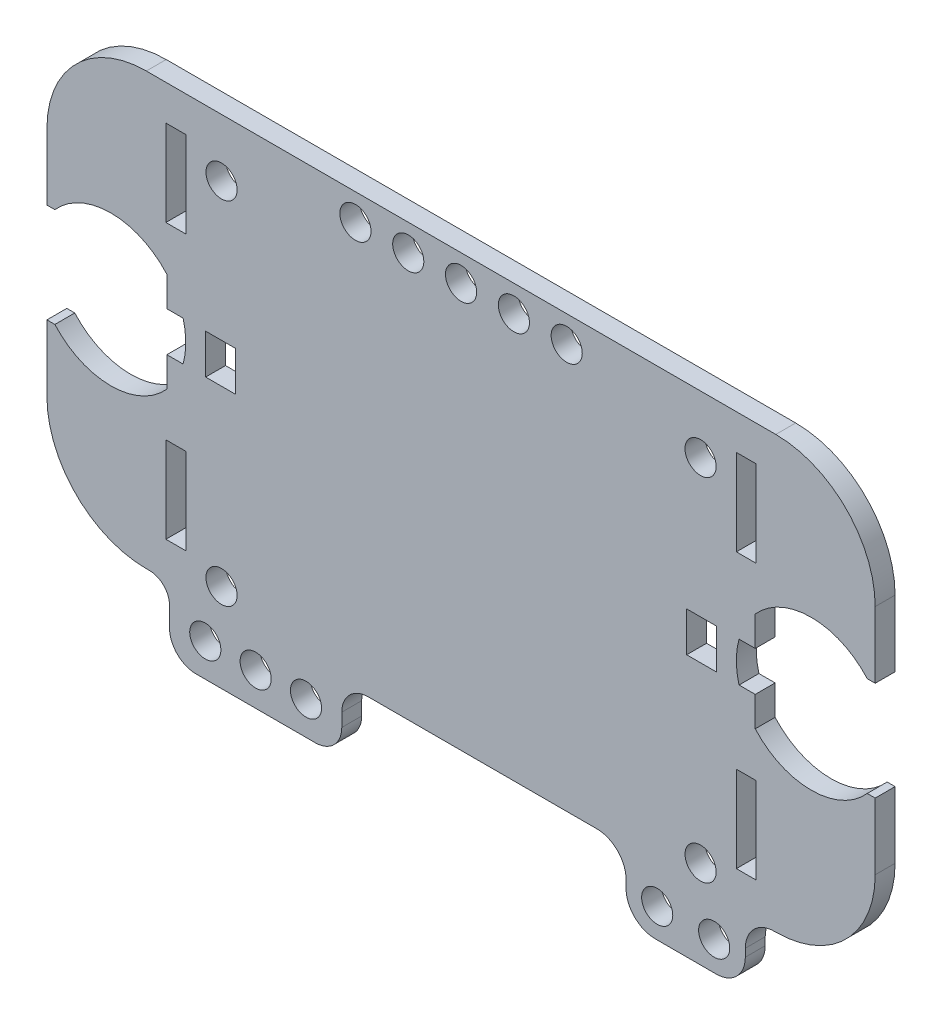
from build123d import *

# Parameters (mm, degrees)
SKICA2_R                 = 2.35
SKICA2_W                 = 4.5
SKICA2_H                 = 6
SKICA2_W_2               = 3
SKICA2_H_2               = 13
P_IDAT_VYSUNUT_M1_DEPTH  = 3
ODEBRAT_VYSUNUT_M2_DEPTH = 76.654647081


with BuildPart() as part:
    # Skica2 → Přidat vysunutím1 (new body)
    with BuildSketch(Plane.XY):
        with BuildLine():
            Line((-62.5, 7.5), (-61.3, 7.5))
            ThreePointArc((-61.3, 7.5), (-52.847781356, 11.3), (-44.395562713, 7.5))
            Line((-44.395562713, 7.5), (-44.395562713, 3))
            Line((-44.395562713, 3), (-41.953287334, 3))
            ThreePointArc((-41.953287334, 3), (-41.547781356, 0), (-41.953287334, -3))
            Line((-41.953287334, -3), (-44.395562713, -3))
            Line((-44.395562713, -3), (-44.395562713, -7.5))
            ThreePointArc((-44.395562713, -7.5), (-52.847781356, -11.3), (-61.3, -7.5))
            Line((-61.3, -7.5), (-62.5, -7.5))
            Line((-62.5, -7.5), (-62.5, -32.525))
            Line((-62.5, -32.525), (-47, -32.525))
            ThreePointArc((-47, -32.525), (-44.878679656, -33.403679656), (-44, -35.525))
            Line((-44, -35.525), (-44, -38.525))
            ThreePointArc((-44, -38.525), (-42.828427125, -41.353427125), (-40, -42.525))
            Line((-40, -42.525), (-22, -42.525))
            ThreePointArc((-22, -42.525), (-19.171572875, -41.353427125), (-18, -38.525))
            Line((-18, -38.525), (-18, -36.525))
            ThreePointArc((-18, -36.525), (-16.828427125, -33.696572875), (-14, -32.525))
            Line((-14, -32.525), (20.5, -32.525))
            ThreePointArc((20.5, -32.525), (23.611269837, -33.813730163), (24.9, -36.925))
            Line((24.9, -36.925), (24.9, -38.1))
            ThreePointArc((24.9, -38.1), (26.188730163, -41.211269837), (29.3, -42.5))
            Line((29.3, -42.5), (38.5, -42.5))
            ThreePointArc((38.5, -42.5), (41.611269837, -41.211269837), (42.9, -38.1))
            Line((42.9, -38.1), (42.9, -36.925))
            ThreePointArc((42.9, -36.925), (44.188730163, -33.813730163), (47.3, -32.525))
            Line((47.3, -32.525), (62.5, -32.525))
            Line((62.5, -32.525), (62.5, -7.5))
            Line((62.5, -7.5), (61.3, -7.5))
            ThreePointArc((61.3, -7.5), (52.847781356, -11.3), (44.395562713, -7.5))
            Line((44.395562713, -7.5), (44.395562713, -3))
            Line((44.395562713, -3), (41.953287334, -3))
            ThreePointArc((41.953287334, -3), (41.547781356, 0), (41.953287334, 3))
            Line((41.953287334, 3), (44.395562713, 3))
            Line((44.395562713, 3), (44.395562713, 7.5))
            ThreePointArc((44.395562713, 7.5), (52.847781356, 11.3), (61.3, 7.5))
            Line((61.3, 7.5), (62.5, 7.5))
            Line((62.5, 7.5), (62.5, 32.525))
            Line((62.5, 32.525), (-62.5, 32.525))
            Line((-62.5, 32.525), (-62.5, 7.5))
        make_face()
        with Locations((-15.94, 28.525)):
            Circle(SKICA2_R, mode=Mode.SUBTRACT)
        with Locations((-7.97, 28.525)):
            Circle(SKICA2_R, mode=Mode.SUBTRACT)
        with Locations((0, 28.525)):
            Circle(SKICA2_R, mode=Mode.SUBTRACT)
        with Locations((7.97, 28.525)):
            Circle(SKICA2_R, mode=Mode.SUBTRACT)
        with Locations((15.94, 28.525)):
            Circle(SKICA2_R, mode=Mode.SUBTRACT)
        with Locations((-36.15, -29.175)):
            Circle(SKICA2_R, mode=Mode.SUBTRACT)
        with Locations((36.15, -29.175)):
            Circle(SKICA2_R, mode=Mode.SUBTRACT)
        with Locations((-36.147781356, 23.825)):
            Circle(SKICA2_R, mode=Mode.SUBTRACT)
        with Locations((36.147781356, 23.825)):
            Circle(SKICA2_R, mode=Mode.SUBTRACT)
        with Locations((-38.6, -37.525)):
            Circle(SKICA2_R, mode=Mode.SUBTRACT)
        with Locations((-31, -37.525)):
            Circle(SKICA2_R, mode=Mode.SUBTRACT)
        with Locations((29.6, -38.1)):
            Circle(SKICA2_R, mode=Mode.SUBTRACT)
        with Locations((38.2, -38.1)):
            Circle(SKICA2_R, mode=Mode.SUBTRACT)
        with Locations((-23.4, -37.525)):
            Circle(SKICA2_R, mode=Mode.SUBTRACT)
        with Locations((-36.297781356, 0)):
            Rectangle(SKICA2_W, SKICA2_H, mode=Mode.SUBTRACT)
        with Locations((-43.047781356, -20.7)):
            Rectangle(SKICA2_W_2, SKICA2_H_2, mode=Mode.SUBTRACT)
        with Locations((-43.047781356, 20.7)):
            Rectangle(SKICA2_W_2, SKICA2_H_2, mode=Mode.SUBTRACT)
        with Locations((43.047781356, -20.7)):
            Rectangle(SKICA2_W_2, SKICA2_H_2, mode=Mode.SUBTRACT)
        with Locations((43.047781356, 20.7)):
            Rectangle(SKICA2_W_2, SKICA2_H_2, mode=Mode.SUBTRACT)
        with Locations((36.297781356, 0)):
            Rectangle(SKICA2_W, SKICA2_H, mode=Mode.SUBTRACT)
    extrude(amount=P_IDAT_VYSUNUT_M1_DEPTH)

    # Skica4 → Odebrat vysunutím2 (cut, through all)
    with BuildSketch(Plane.XY.offset(3)):
        with BuildLine():
            Line((-47.5, 32.525), (-62.5, 32.525))
            Line((-62.5, 32.525), (-62.5, 17.525))
            ThreePointArc((-62.5, 17.525), (-58.106601718, 28.131601718), (-47.5, 32.525))
        make_face()
        with BuildLine():
            Line((62.5, 17.525), (62.5, 32.525))
            Line((62.5, 32.525), (47.5, 32.525))
            ThreePointArc((47.5, 32.525), (58.106601718, 28.131601718), (62.5, 17.525))
        make_face()
        with BuildLine():
            Line((-62.5, -17.525), (-62.5, -32.525))
            Line((-62.5, -32.525), (-47.5, -32.525))
            ThreePointArc((-47.5, -32.525), (-58.106601718, -28.131601718), (-62.5, -17.525))
        make_face()
        with BuildLine():
            Line((47.5, -32.525), (62.5, -32.525))
            Line((62.5, -32.525), (62.5, -17.525))
            ThreePointArc((62.5, -17.525), (58.106601718, -28.131601718), (47.5, -32.525))
        make_face()
    extrude(amount=-ODEBRAT_VYSUNUT_M2_DEPTH, mode=Mode.SUBTRACT)


solid = part.part
